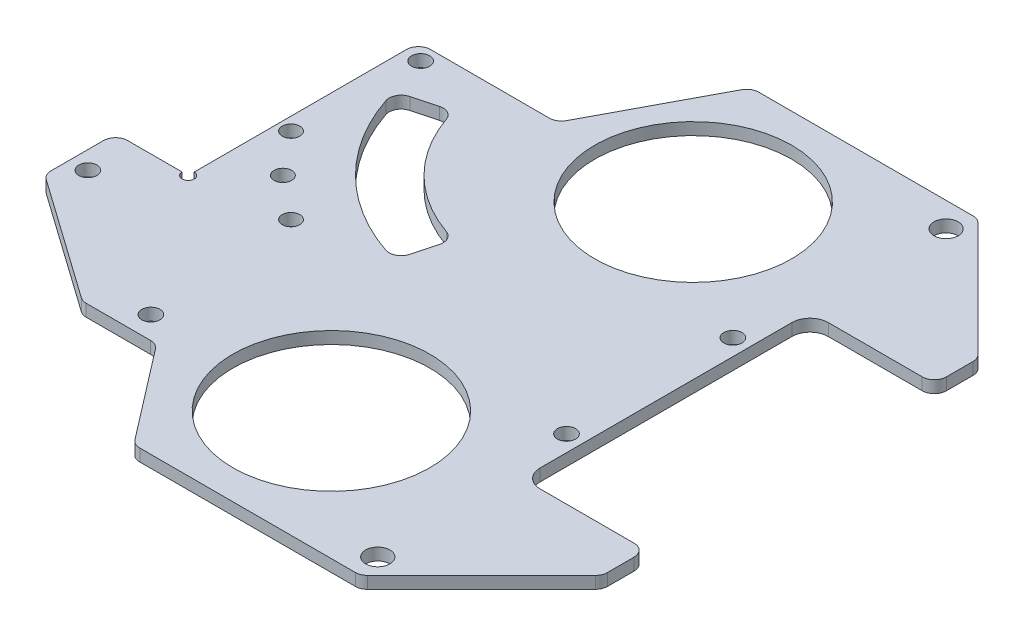
from build123d import *

# Parameters (mm, degrees)
SKETCH1_R           = 16.264719519
SKETCH1_R_2         = 1.5
SKETCH1_R_3         = 1.45
BOSS_EXTRUDE1_DEPTH = 2
SKETCH2_R           = 2
CUT_EXTRUDE1_DEPTH  = 119.16416129
FILLET1_R           = 2
SKETCH3_R           = 1
CUT_EXTRUDE2_DEPTH  = 10


with BuildPart() as part:
    # Sketch1 → Boss-Extrude1 (new body)
    with BuildSketch(Plane(origin=(0, 0, 0), x_dir=(1, 0, 0), z_dir=(0, 1, 0))):
        with BuildLine():
            Line((-12.392234006, -6.981301864), (-12.392234006, -30.758658484))
            Line((-12.392234006, -30.758658484), (-12.392234006, -37.869980174))
            Line((-12.392234006, -37.869980174), (-12.392234006, -39.662475092))
            ThreePointArc((-12.392234006, -39.662475092), (-11.513554349, -41.783795436), (-9.392234006, -42.662475092))
            Line((-9.392234006, -42.662475092), (8.128346254, -42.662475092))
            Line((8.128346254, -42.662475092), (8.128346254, -49.872480174))
            Line((8.128346254, -49.872480174), (-11.871653746, -69.872480174))
            Line((-11.871653746, -69.872480174), (-49.281653746, -69.872480174))
            Line((-49.281653746, -69.872480174), (-61.796944846, -53.596788721))
            Line((-61.796944846, -53.596788721), (-74.058017443, -53.596788721))
            Line((-74.058017443, -53.596788721), (-95.271220878, -38.596788721))
            Line((-95.271220878, -38.596788721), (-95.271220878, -26.897908721))
            Line((-95.271220878, -26.897908721), (-84.130114655, -26.897908721))
            Line((-84.130114655, -26.897908721), (-83.276622696, -26.897908721))
            Line((-83.276622696, -26.897908721), (-83.276622696, 11.130019826))
            Line((-83.276622696, 11.130019826), (-60.448477034, 11.130019826))
            Line((-60.448477034, 11.130019826), (-49.281653746, 32.132519826))
            Line((-49.281653746, 32.132519826), (-11.871653746, 32.132519826))
            Line((-11.871653746, 32.132519826), (8.128346254, 12.132519826))
            Line((8.128346254, 12.132519826), (8.128346254, 4.922514744))
            Line((8.128346254, 4.922514744), (-9.392234006, 4.922514744))
            ThreePointArc((-9.392234006, 4.922514744), (-11.513554349, 4.043835088), (-12.392234006, 1.922514744))
            Line((-12.392234006, 1.922514744), (-12.392234006, 0.130019826))
            Line((-12.392234006, 0.130019826), (-12.392234006, -6.981301864))
        make_face()
        with Locations((-37.781653746, -48.747480173)):
            Circle(SKETCH1_R, mode=Mode.SUBTRACT)
        with Locations((-37.781653746, 11.007519825)):
            Circle(SKETCH1_R, mode=Mode.SUBTRACT)
        with Locations((-15.087114055, -5.127161907)):
            Circle(SKETCH1_R_2, mode=Mode.SUBTRACT)
        with Locations((-15.087114055, -32.612798441)):
            Circle(SKETCH1_R_2, mode=Mode.SUBTRACT)
        with Locations((-81.12792954, -12.064242343)):
            Circle(SKETCH1_R_3, mode=Mode.SUBTRACT)
        with Locations((-75.470082252, -19.063439731)):
            Circle(SKETCH1_R_3, mode=Mode.SUBTRACT)
        with Locations((-68.470884865, -24.721287018)):
            Circle(SKETCH1_R_3, mode=Mode.SUBTRACT)
        with Locations((-92.311157954, -34.437864429)):
            Circle(SKETCH1_R_2, mode=Mode.SUBTRACT)
        with Locations((-66.462987255, -49.872480174)):
            Circle(SKETCH1_R_2, mode=Mode.SUBTRACT)
        with Locations((-80.455556672, 8.666951386)):
            Circle(SKETCH1_R_2, mode=Mode.SUBTRACT)
        with BuildLine():
            Line((-52.664953624, -16.00672876), (-53.702548501, -19.879085561))
            ThreePointArc((-53.702548501, -19.879085561), (-54.689042095, -21.123916801), (-56.271766971, -21.257169903))
            ThreePointArc((-56.271766971, -21.257169903), (-69.478161637, -13.071519115), (-77.663812425, 0.13487555))
            ThreePointArc((-77.663812425, 0.13487555), (-77.530559323, 1.717600427), (-76.285728083, 2.70409402))
            Line((-76.285728083, 2.70409402), (-72.413371282, 3.741688898))
            ThreePointArc((-72.413371282, 3.741688898), (-70.958270463, 3.576518776), (-70.005790184, 2.464142545))
            ThreePointArc((-70.005790184, 2.464142545), (-63.821307387, -7.414664865), (-53.942499976, -13.599147662))
            ThreePointArc((-53.942499976, -13.599147662), (-52.830123745, -14.551627941), (-52.664953624, -16.00672876))
        make_face(mode=Mode.SUBTRACT)
    extrude(amount=BOSS_EXTRUDE1_DEPTH)

    # Sketch2 → Cut-Extrude1 (cut, through all)
    with BuildSketch(Plane(origin=(0, 2, 0), x_dir=(1, 0, 0), z_dir=(0, 1, 0))):
        with Locations((-13.067528443, -65.799136603)):
            Circle(SKETCH2_R)
        with Locations((-13.067528443, 28.059176255)):
            Circle(SKETCH2_R)
    extrude(amount=-CUT_EXTRUDE1_DEPTH, mode=Mode.SUBTRACT)

    # Fillet1
    fillet1_edges = [part.edges().sort_by_distance(p)[0] for p in [
        (-11.871653746, 1, -32.132519826),
        (8.128346254, 1, -4.922514744),
        (8.128346254, 1, -12.132519826),
        (8.128346254, 1, 49.872480174),
        (8.128346254, 1, 42.662475092),
        (-11.871653746, 1, 69.872480174),
        (-49.281653746, 1, 69.872480174),
        (-61.796944846, 1, 53.596788721),
        (-74.058017443, 1, 53.596788721),
        (-95.271220878, 1, 38.596788721),
        (-95.271220878, 1, 26.897908721),
        (-83.276622696, 1, -11.130019826),
        (-60.448477034, 1, -11.130019826),
        (-49.281653746, 1, -32.132519826),
    ]]
    fillet(fillet1_edges, radius=FILLET1_R)

    # Sketch3 → Cut-Extrude2 (cut)
    with BuildSketch(Plane(origin=(0, 2, 0), x_dir=(1, 0, 0), z_dir=(0, 1, 0))):
        with Locations((-83.276622696, -26.897908721)):
            Circle(SKETCH3_R)
    extrude(amount=-CUT_EXTRUDE2_DEPTH, mode=Mode.SUBTRACT)


solid = part.part
